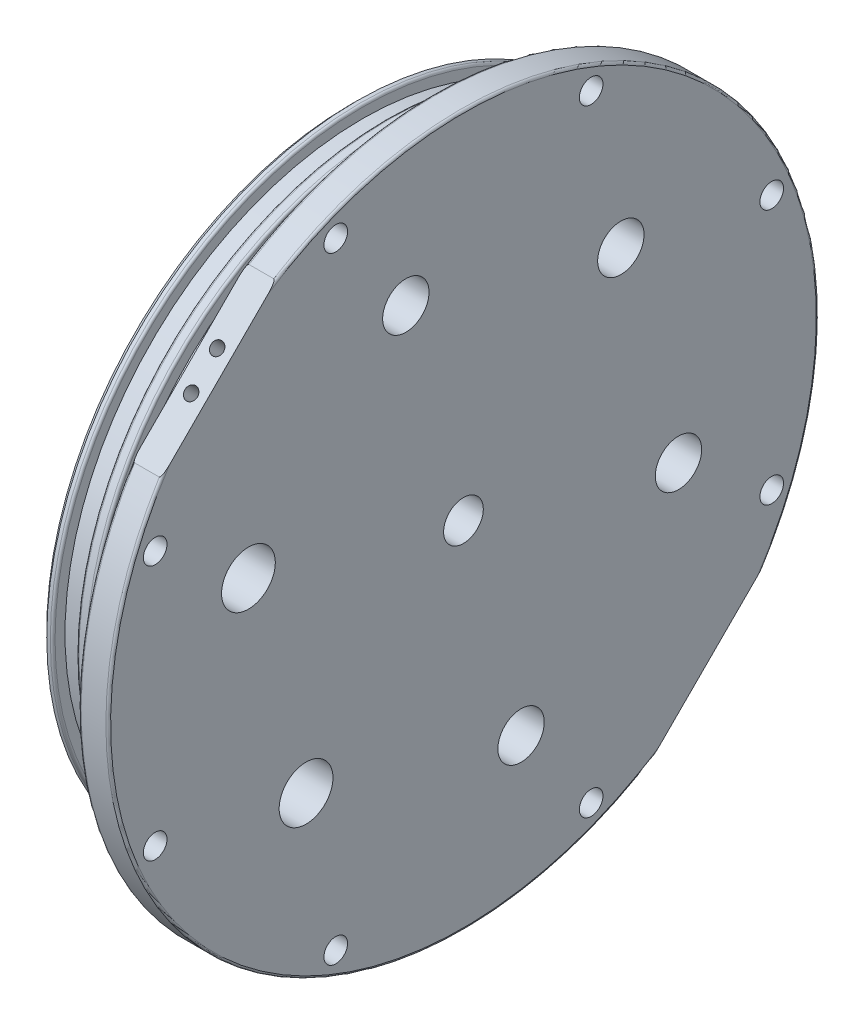
from build123d import *

# Parameters (mm, degrees)
CHAMFER1_SIZE                  = 1.27
FILLET1_R                      = 0.508
F_8_0_199_DIAMETER_HOLE1_D     = 5.0546
F_8_0_199_DIAMETER_HOLE1_DEPTH = 9.149444958
F_8_0_199_DIAMETER_HOLE1_TIP   = 1.518555042
CUT_EXTRUDE1_START             = -6.300196078
CUT_EXTRUDE1_DEPTH             = 6.300196078
F_6_32_TAPPED_HOLE1_AT_2_COUNT = 2
F_6_32_TAPPED_HOLE1_AT_2_PITCH = 7.874
M10X1_5_TAPPED_HOLE1_D         = 8.5
M10X1_5_TAPPED_HOLE1_DEPTH     = 27.926342369
M10X1_5_TAPPED_HOLE1_TIP       = 2.553657631
F_7_16_20_TAPPED_HOLE1_D       = 9.92124
F_7_16_20_TAPPED_HOLE1_DEPTH   = 27.499358796
F_7_16_20_TAPPED_HOLE1_TIP     = 2.980641204
F_1_2_20_TAPPED_HOLE1_D        = 11.50874
F_1_2_20_TAPPED_HOLE1_DEPTH    = 25.75242568
F_1_2_20_TAPPED_HOLE1_TIP      = 3.45757432
F_8_32_TAPPED_HOLE1_D          = 3.4544
F_8_32_TAPPED_HOLE1_DEPTH      = 9.721633539
F_8_32_TAPPED_HOLE1_TIP        = 1.037806461


# Read off the part's stored shape, not the designer's step: Cut-Extrude1
with BuildPart() as part:
    # Sketch1 → Revolve1 (revolve)
    with BuildSketch(Plane.XY, mode=Mode.PRIVATE) as revolve1_sk:
        Polygon((24.13, -58.42), (24.13, -76), (17.829803922, -76), (17.829803922, -66.421), (17.829803922, -66.294), (15.289803922, -66.294), (15.289803922, -63.65748), (10.184901961, -63.65748), (10.184901961, -66.294), (7.644901961, -66.294), (7.644901961, -63.65748), (2.54, -63.65748), (2.54, -66.294), (0, -66.294), (0, -58.42), (0, 0), (11.43, 0), (24.13, 0), align=None)
    revolve(revolve1_sk.sketch.rotate(Axis((24.13, 0, 0), (-1, 0, 0)), 180), axis=Axis((24.13, 0, 0), (-1, 0, 0)))

    # Chamfer1
    chamfer1_edges = [part.edges().sort_by_distance(p)[0] for p in [
        (0, -66.294, 0),
    ]]
    chamfer(chamfer1_edges, length=CHAMFER1_SIZE)

    # Fillet1
    fillet1_edges = [part.edges().sort_by_distance(p)[0] for p in [
        (24.13, -76, 0),
        (17.829803922, -76, 0),
        (15.289803922, -66.294, 0),
        (10.184901961, -66.294, 0),
        (7.644901961, -66.294, 0),
        (2.54, -66.294, 0),
    ]]
    fillet(fillet1_edges, radius=FILLET1_R)

    # #8 (0.199) Diameter Hole1
    with Locations(Plane(origin=(24.13, 0, 0), x_dir=(0, 0, -1), z_dir=(1, 0, 0))):
        with Locations((-65.952711024, 27.318507381), (-27.318507381, 65.952711024), (27.318507381, 65.952711024), (65.952711024, 27.318507381), (65.952711024, -27.318507381), (27.318507381, -65.952711024), (-27.318507381, -65.952711024), (-65.952711024, -27.318507381)):
            Hole(F_8_0_199_DIAMETER_HOLE1_D / 2, depth=F_8_0_199_DIAMETER_HOLE1_DEPTH)
            with Locations((0, 0, -(F_8_0_199_DIAMETER_HOLE1_DEPTH + F_8_0_199_DIAMETER_HOLE1_TIP / 2))):  # 118° drill point
                Cone(0, F_8_0_199_DIAMETER_HOLE1_D / 2, F_8_0_199_DIAMETER_HOLE1_TIP, mode=Mode.SUBTRACT)

    # Cut-Extrude1 outline → Cut-Extrude1 (cut)
    with BuildSketch(Plane(origin=(24.13, 0, 0), x_dir=(0, 0, -1), z_dir=(1, 0, 0)).offset(CUT_EXTRUDE1_START)):
        with BuildLine():
            ThreePointArc((-40.078453094, 64.573350522), (-53.74011537, 53.74011537), (-64.573350522, 40.078453094))
            Line((-64.573350522, 40.078453094), (-40.078453094, 64.573350522))
        make_face()
    cut_extrude1 = extrude(amount=CUT_EXTRUDE1_DEPTH, mode=Mode.SUBTRACT)

    # Sketch9 → #6-32 Tapped Hole1 (revolve, cut)
    with BuildSketch(Plane(origin=(20.979901961, 55.109781205, 49.54202241), x_dir=(0, -0.7071067811865474, 0.7071067811865477), z_dir=(1, 0, 0))):
        Polygon((0, 0), (0, 19.05), (1.35255, 18.23730597), (1.35255, 0), align=None)
    f_6_32_tapped_hole1 = revolve(axis=Axis((20.979901961, 59.599909266, 54.032150471), (0, -0.7071067811865478, -0.7071067811865474)), mode=Mode.SUBTRACT)

    # #6-32 Tapped Hole1 at 2: #6-32 Tapped Hole1 ×2
    with Locations(*[Vector(0, -0.7071067811865471, 0.7071067811865479) * (i * F_6_32_TAPPED_HOLE1_AT_2_PITCH) for i in range(1, F_6_32_TAPPED_HOLE1_AT_2_COUNT)]):
        add(f_6_32_tapped_hole1, mode=Mode.SUBTRACT)

    # Mirror1: Cut-Extrude1, #6-32 Tapped Hole1 across plane
    add(cut_extrude1.mirror(Plane(origin=(0, 0, 0), x_dir=(0, -0.7071067811865478, 0.7071067811865474), z_dir=(0, 0.7071067811865472, 0.7071067811865478))), mode=Mode.SUBTRACT)
    add(f_6_32_tapped_hole1.mirror(Plane(origin=(0, 0, 0), x_dir=(0, -0.7071067811865478, 0.7071067811865474), z_dir=(0, 0.7071067811865472, 0.7071067811865478))), mode=Mode.SUBTRACT)

    # Mirror1 copy 1 sketch → Mirror1 copy 1 (revolve, cut)
    with BuildSketch(Plane(origin=(20.979901961, -55.109781205, -49.54202241), x_dir=(0, -0.7071067811865482, 0.7071067811865469), z_dir=(1, 0, 0))):
        Polygon((0, 0), (0, -19.05), (1.35255, -18.23730597), (1.35255, 0), align=None)
    revolve(axis=Axis((20.979901961, -59.599909266, -54.032150471), (0, -0.7071067811865468, -0.7071067811865482)), mode=Mode.SUBTRACT)

    # M10x1.5 Tapped Hole1
    with Locations(Plane(origin=(24.13, 0, 0), x_dir=(0, 0, -1), z_dir=(1, 0, 0))):
        with Locations((0, 0)):
            Hole(M10X1_5_TAPPED_HOLE1_D / 2, depth=M10X1_5_TAPPED_HOLE1_DEPTH)
            with Locations((0, 0, -(M10X1_5_TAPPED_HOLE1_DEPTH + M10X1_5_TAPPED_HOLE1_TIP / 2))):  # 118° drill point
                Cone(0, M10X1_5_TAPPED_HOLE1_D / 2, M10X1_5_TAPPED_HOLE1_TIP, mode=Mode.SUBTRACT)

    # 7/16-20 Tapped Hole1
    with Locations(Plane(origin=(24.13, 0, 0), x_dir=(0, 0, -1), z_dir=(1, 0, 0))):
        with Locations((12.326257023, -46.002217477), (-12.326257023, 46.002217477), (33.675960454, 33.675960454), (46.002217477, -12.326257023)):
            Hole(F_7_16_20_TAPPED_HOLE1_D / 2, depth=F_7_16_20_TAPPED_HOLE1_DEPTH)
            with Locations((0, 0, -(F_7_16_20_TAPPED_HOLE1_DEPTH + F_7_16_20_TAPPED_HOLE1_TIP / 2))):  # 118° drill point
                Cone(0, F_7_16_20_TAPPED_HOLE1_D / 2, F_7_16_20_TAPPED_HOLE1_TIP, mode=Mode.SUBTRACT)

    # 1/2-20 Tapped Hole1
    with Locations(Plane(origin=(24.13, 0, 0), x_dir=(0, 0, -1), z_dir=(1, 0, 0))):
        with Locations((-46.002217477, 12.326257023), (-33.675960454, -33.675960454)):
            Hole(F_1_2_20_TAPPED_HOLE1_D / 2, depth=F_1_2_20_TAPPED_HOLE1_DEPTH)
            with Locations((0, 0, -(F_1_2_20_TAPPED_HOLE1_DEPTH + F_1_2_20_TAPPED_HOLE1_TIP / 2))):  # 118° drill point
                Cone(0, F_1_2_20_TAPPED_HOLE1_D / 2, F_1_2_20_TAPPED_HOLE1_TIP, mode=Mode.SUBTRACT)

    # #8-32 Tapped Hole1
    with Locations(Plane.ZY):
        with Locations((-9.963187377, 37.183121498), (27.21993412, 27.21993412), (37.183121498, -9.963187377), (9.963187377, -37.183121498), (-27.21993412, -27.21993412), (-37.183121498, 9.963187377)):
            Hole(F_8_32_TAPPED_HOLE1_D / 2, depth=F_8_32_TAPPED_HOLE1_DEPTH)
            with Locations((0, 0, -(F_8_32_TAPPED_HOLE1_DEPTH + F_8_32_TAPPED_HOLE1_TIP / 2))):  # 118° drill point
                Cone(0, F_8_32_TAPPED_HOLE1_D / 2, F_8_32_TAPPED_HOLE1_TIP, mode=Mode.SUBTRACT)


solid = part.part
